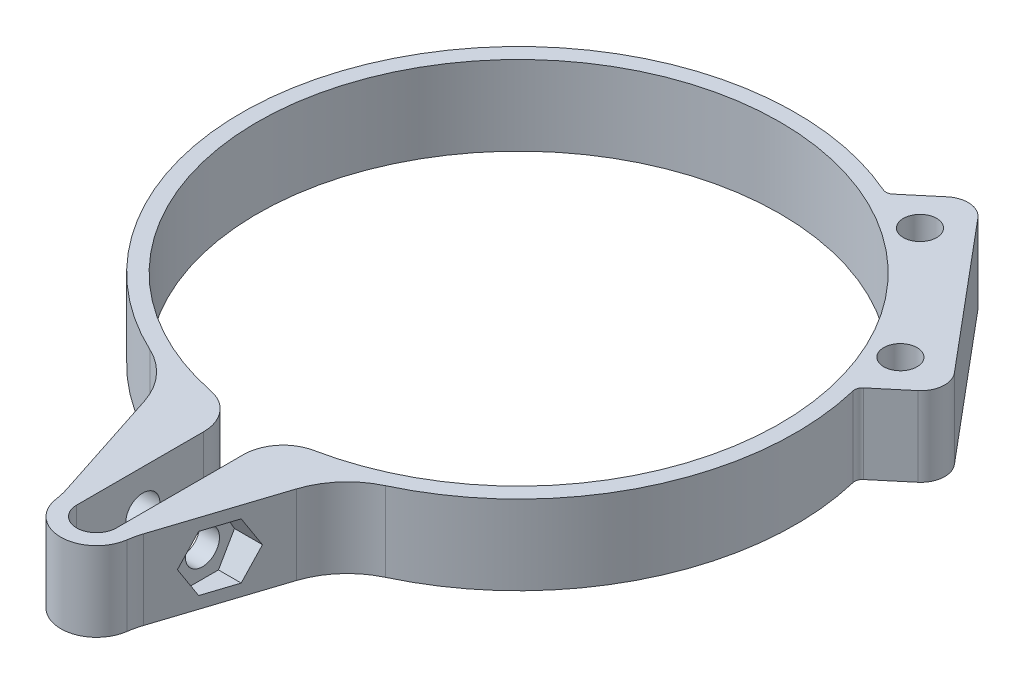
from build123d import *

# Parameters (mm, degrees)
SKETCH1_R               = 2.1
BOSS_EXTRUDE1_DEPTH     = 10
CUT_EXTRUDE1_DEPTH      = 10
CUT_EXTRUDE1_DEPTH_BACK = 10
SKETCH3_R               = 2.15
CUT_EXTRUDE2_START      = -6
SKETCH4_R               = 3.75
CUT_EXTRUDE2_DEPTH      = 10
CUT_EXTRUDE3_START      = -2.5
CUT_EXTRUDE3_DEPTH      = 10


with BuildPart() as part:
    # Sketch1 → Boss-Extrude1 (new body)
    with BuildSketch(Plane(origin=(0, 0, 0), x_dir=(1, 0, 0), z_dir=(0, 1, 0))):
        with BuildLine():
            Line((38.355229041, 16.51897107), (22.928326409, 34.904037705))
            ThreePointArc((22.928326409, 34.904037705), (20.891660307, 35.96425897), (18.70183025, 35.273808205))
            Line((18.70183025, 35.273808205), (14.981111589, 32.151754549))
            ThreePointArc((14.981111589, 32.151754549), (14.481497375, 31.928101372), (13.938983386, 32.000996346))
            ThreePointArc((13.938983386, 32.000996346), (-31.802778701, 14.385488935), (-14.829176591, -31.59833139))
            ThreePointArc((-14.829176591, -31.59833139), (-11.579923366, -34.034003552), (-9.567050503, -37.560827652))
            Line((-9.567050503, -37.560827652), (-4.848288245, -52.083684568))
            ThreePointArc((-4.848288245, -52.083684568), (-4.61517148, -52.924262884), (-4.456195885, -53.781958687))
            ThreePointArc((-4.456195885, -53.781958687), (-2.952237368, -56.551823245), (0, -57.655605566))
            ThreePointArc((0, -57.655605566), (2.952237368, -56.551823245), (4.456195885, -53.781958687))
            ThreePointArc((4.456195885, -53.781958687), (4.61517148, -52.924262884), (4.848288245, -52.083684568))
            Line((4.848288245, -52.083684568), (9.567050503, -37.560827652))
            ThreePointArc((9.567050503, -37.560827652), (11.579923366, -34.034003552), (14.829176591, -31.59833139))
            ThreePointArc((14.829176591, -31.59833139), (31.462355963, -15.115527853), (33.935308369, 8.170304209))
            ThreePointArc((33.935308369, 8.170304209), (33.957727399, 8.717234271), (34.264739879, 9.170421255))
            Line((34.264739879, 9.170421255), (37.985458541, 12.292474912))
            ThreePointArc((37.985458541, 12.292474912), (39.045679806, 14.329141013), (38.355229041, 16.51897107))
        make_face()
        with BuildLine():
            Line((-2.5, -53.155605566), (-2.5, -37.155605566))
            ThreePointArc((-2.5, -37.155605566), (-3.630466632, -33.989107261), (-6.510684606, -32.254457226))
            ThreePointArc((-6.510684606, -32.254457226), (0, 32.905), (6.510684606, -32.254457226))
            ThreePointArc((6.510684606, -32.254457226), (3.630466632, -33.989107261), (2.5, -37.155605566))
            Line((2.5, -37.155605566), (2.5, -53.155605566))
            ThreePointArc((2.5, -53.155605566), (0, -55.655605566), (-2.5, -53.155605566))
        make_face(mode=Mode.SUBTRACT)
        with Locations((20.383679412, 30.15801077)):
            Circle(SKETCH1_R, mode=Mode.SUBTRACT)
        with Locations((33.239431606, 14.837121908)):
            Circle(SKETCH1_R, mode=Mode.SUBTRACT)
    extrude(amount=BOSS_EXTRUDE1_DEPTH)

    # Sketch3 → Cut-Extrude1 (cut, two sides: drawn at the far end of the back side and taken through both)
    with BuildSketch(Plane(origin=(0, 0, 0), x_dir=(0, 0, -1), z_dir=(1, 0, 0)).offset(-CUT_EXTRUDE1_DEPTH_BACK)):
        with Locations((-44.82225611, 5)):
            Circle(SKETCH3_R)
    extrude(amount=CUT_EXTRUDE1_DEPTH + CUT_EXTRUDE1_DEPTH_BACK, mode=Mode.SUBTRACT)

    # Sketch4 → Cut-Extrude2 (cut)
    with BuildSketch(Plane(origin=(0, 0, 0), x_dir=(0, 0, -1), z_dir=(1, 0, 0)).offset(CUT_EXTRUDE2_START)):
        with Locations((-44.82225611, 5)):
            Circle(SKETCH4_R)
    extrude(amount=-CUT_EXTRUDE2_DEPTH, mode=Mode.SUBTRACT)

    # Sketch5 → Cut-Extrude3 (cut)
    with BuildSketch(Plane.ZY.offset(-2.5).offset(CUT_EXTRUDE3_START)):
        Polygon((46.842982052, 8.5), (42.801530168, 8.5), (40.780804226, 5), (42.801530168, 1.5), (46.842982052, 1.5), (48.863707994, 5), align=None)
    extrude(amount=-CUT_EXTRUDE3_DEPTH, mode=Mode.SUBTRACT)


solid = part.part
